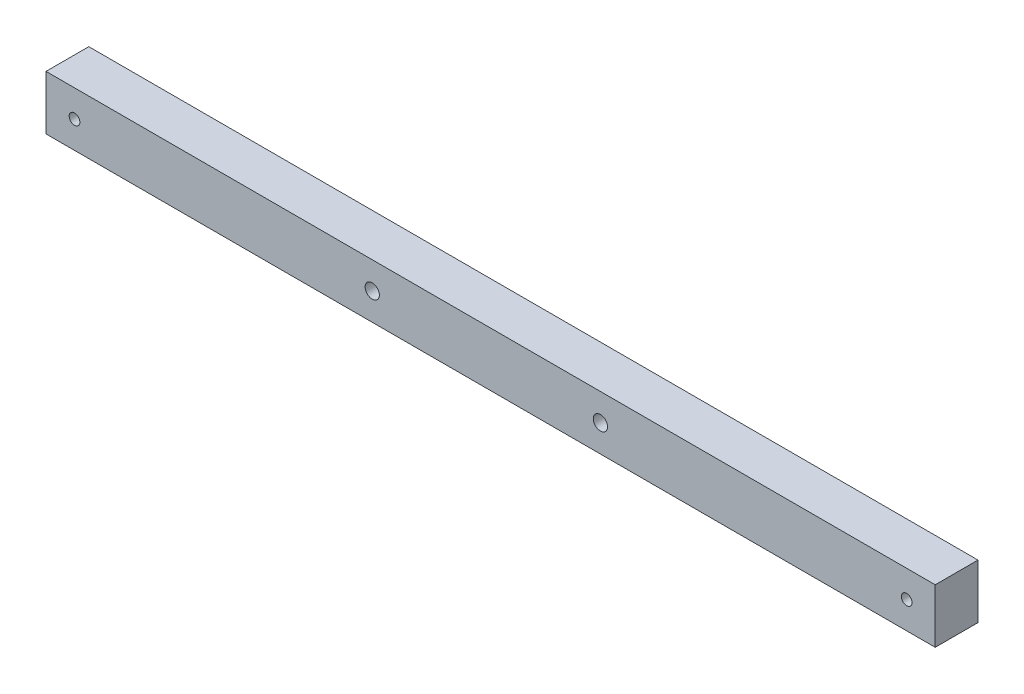
from build123d import *

# Parameters (mm, degrees)
SKETCH_2_W          = 62.35
SKETCH_2_H          = 3.8
SKETCH_2_R          = 0.5
EXTRUDE_1_DEPTH     = 3
CUT_EXTRUDE_1_REACH = 33.377
SKETCH_3_R          = 0.375


with BuildPart() as part:
    # 草图2 → 凸台-拉伸1 (new body)
    with BuildSketch(Plane.XY):
        Rectangle(SKETCH_2_W, SKETCH_2_H)
        with Locations((7.7, 0)):
            Circle(SKETCH_2_R, mode=Mode.SUBTRACT)
        with Locations((-8.3, 0)):
            Circle(SKETCH_2_R, mode=Mode.SUBTRACT)
    extrude(amount=EXTRUDE_1_DEPTH)

    # 草图3 → 切除-拉伸1 (cut, up to next)
    with BuildSketch(Plane(origin=(0, 0, 0), x_dir=(-1, 0, 0), z_dir=(0, 0, -1)), mode=Mode.PRIVATE) as cut_extrude_1_sk1:
        with Locations((29.175, 0)):
            Circle(SKETCH_3_R)
    cut_extrude_1_tool1 = extrude(cut_extrude_1_sk1.sketch, amount=-CUT_EXTRUDE_1_REACH, mode=Mode.PRIVATE) & part.part
    # 草图3 → 切除-拉伸1 (cut, up to next)
    with BuildSketch(Plane(origin=(0, 0, 0), x_dir=(-1, 0, 0), z_dir=(0, 0, -1)), mode=Mode.PRIVATE) as cut_extrude_1_sk2:
        with Locations((-29.175, 0)):
            Circle(SKETCH_3_R)
    cut_extrude_1_tool2 = extrude(cut_extrude_1_sk2.sketch, amount=-CUT_EXTRUDE_1_REACH, mode=Mode.PRIVATE) & part.part
    add(cut_extrude_1_tool1.solids().sort_by_distance((-29.175, 0, 0))[0], mode=Mode.SUBTRACT)
    add(cut_extrude_1_tool2.solids().sort_by_distance((29.175, 0, 0))[0], mode=Mode.SUBTRACT)


solid = part.part
